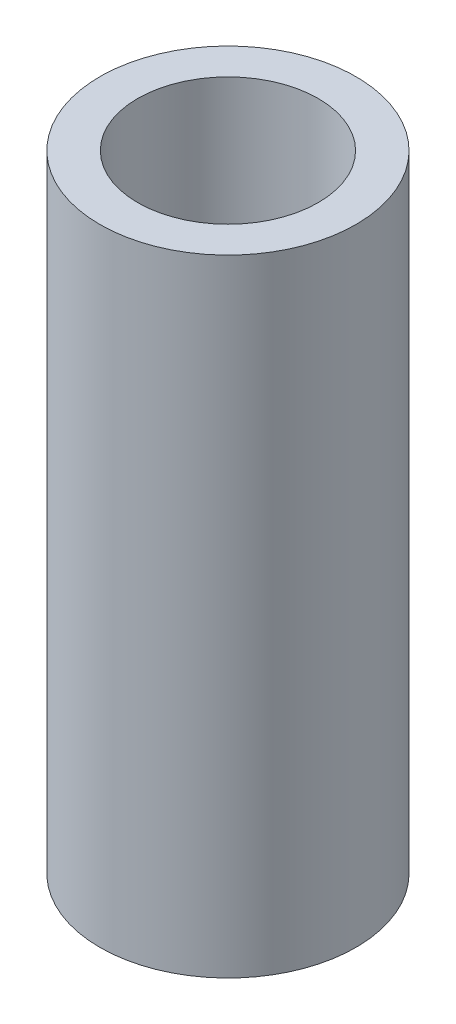
from build123d import *

# Parameters (mm, degrees)
SKETCH1_R           = 35
BOSS_EXTRUDE1_DEPTH = 171.102827835
SKETCH2_R           = 24.668626068
CUT_EXTRUDE1_DEPTH  = 179.118437263


with BuildPart() as part:
    # Sketch1 → Boss-Extrude1 (new body)
    with BuildSketch(Plane(origin=(0, 0, 0), x_dir=(1, 0, 0), z_dir=(0, 1, 0))):
        Circle(SKETCH1_R)
    extrude(amount=BOSS_EXTRUDE1_DEPTH)

    # Sketch2 → Cut-Extrude1 (cut, through all)
    with BuildSketch(Plane(origin=(0, 0, 0), x_dir=(1, 0, 0), z_dir=(0, 1, 0))):
        Circle(SKETCH2_R)
    extrude(amount=CUT_EXTRUDE1_DEPTH, mode=Mode.SUBTRACT)


solid = part.part
